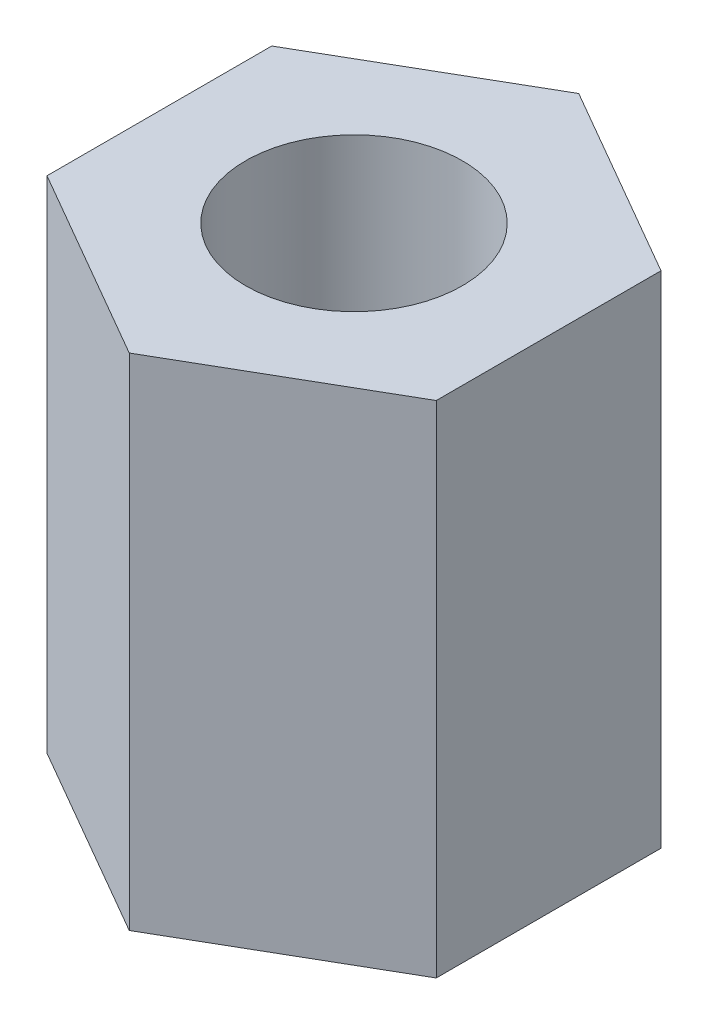
from build123d import *

# Parameters (mm, degrees)
SKETCH1_R           = 1.3
BOSS_EXTRUDE1_DEPTH = 6


with BuildPart() as part:
    # Sketch1 → Boss-Extrude1 (new body)
    with BuildSketch(Plane(origin=(0, 0, 0), x_dir=(1, 0, 0), z_dir=(0, 1, 0))):
        Polygon((0, -2.696225757), (2.335, -1.348112879), (2.335, 1.348112879), (0, 2.696225757), (-2.335, 1.348112879), (-2.335, -1.348112879), align=None)
        Circle(SKETCH1_R, mode=Mode.SUBTRACT)
    extrude(amount=BOSS_EXTRUDE1_DEPTH)


solid = part.part
